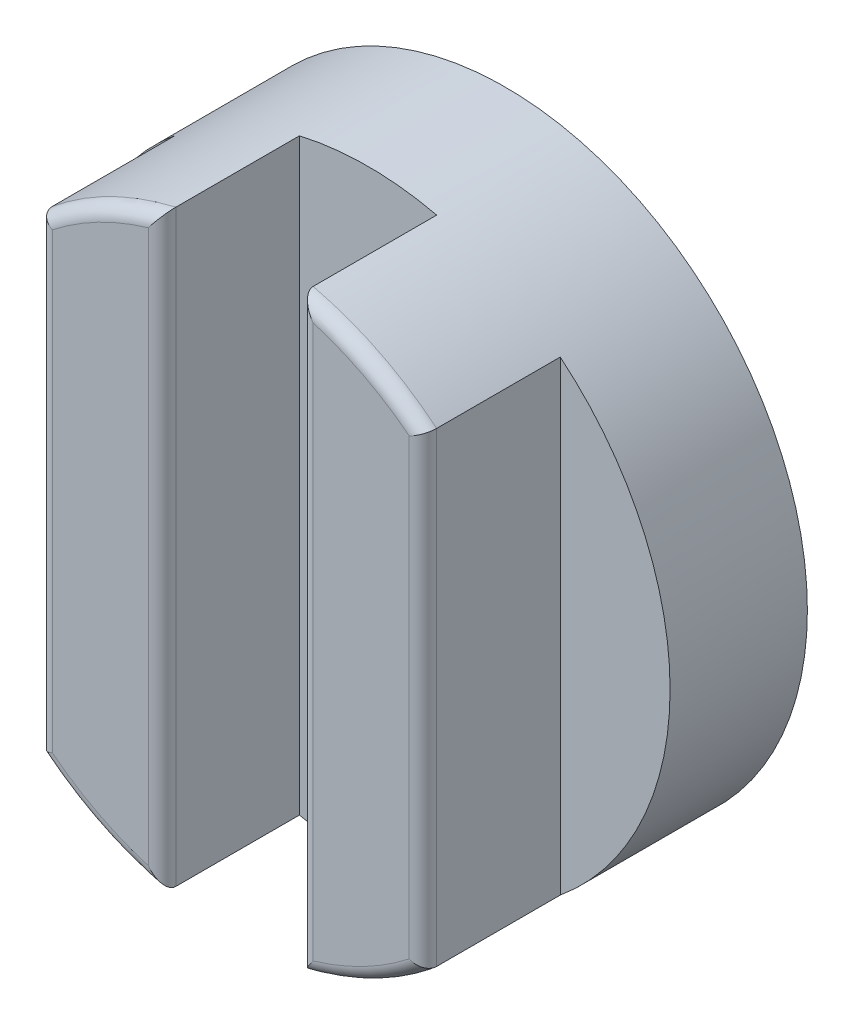
from build123d import *

# Parameters (mm, degrees)
ESQUISSE1_R        = 11
BOSS_EXTRU_1_DEPTH = 5
BOSS_EXTRU_3_DEPTH = 5
CONG_3_R           = 0.5


with BuildPart() as part:
    # Esquisse1 → Boss.-Extru.1 (new body)
    with BuildSketch(Plane.XY):
        Circle(ESQUISSE1_R)
    extrude(amount=BOSS_EXTRU_1_DEPTH)

    # Esquisse2 → Boss.-Extru.3 (add)
    with BuildSketch(Plane.XY.offset(5)):
        with BuildLine():
            ThreePointArc((-2.5, 10.712142643), (-4.878752687, 9.858893053), (-7, 8.485281374))
            Line((-7, 8.485281374), (-7, -8.485281374))
            ThreePointArc((-7, -8.485281374), (-4.878752687, -9.858893053), (-2.5, -10.712142643))
            Line((-2.5, -10.712142643), (-2.5, 10.712142643))
        make_face()
        with BuildLine():
            ThreePointArc((7, 8.485281374), (4.878752687, 9.858893053), (2.5, 10.712142643))
            Line((2.5, 10.712142643), (2.5, -10.712142643))
            ThreePointArc((2.5, -10.712142643), (4.878752687, -9.858893053), (7, -8.485281374))
            Line((7, -8.485281374), (7, 8.485281374))
        make_face()
    extrude(amount=BOSS_EXTRU_3_DEPTH)

    # Congé3
    cong_3_edges = [part.edges().sort_by_distance(p)[0] for p in [
        (4.878752687, 9.858893053, 10),
        (7, 0, 10),
        (2.5, 0, 10),
        (4.878752687, -9.858893053, 10),
        (-4.878752687, -9.858893053, 10),
        (-2.5, 0, 10),
        (-4.878752687, 9.858893053, 10),
        (-7, 0, 10),
    ]]
    fillet(cong_3_edges, radius=CONG_3_R)


solid = part.part
